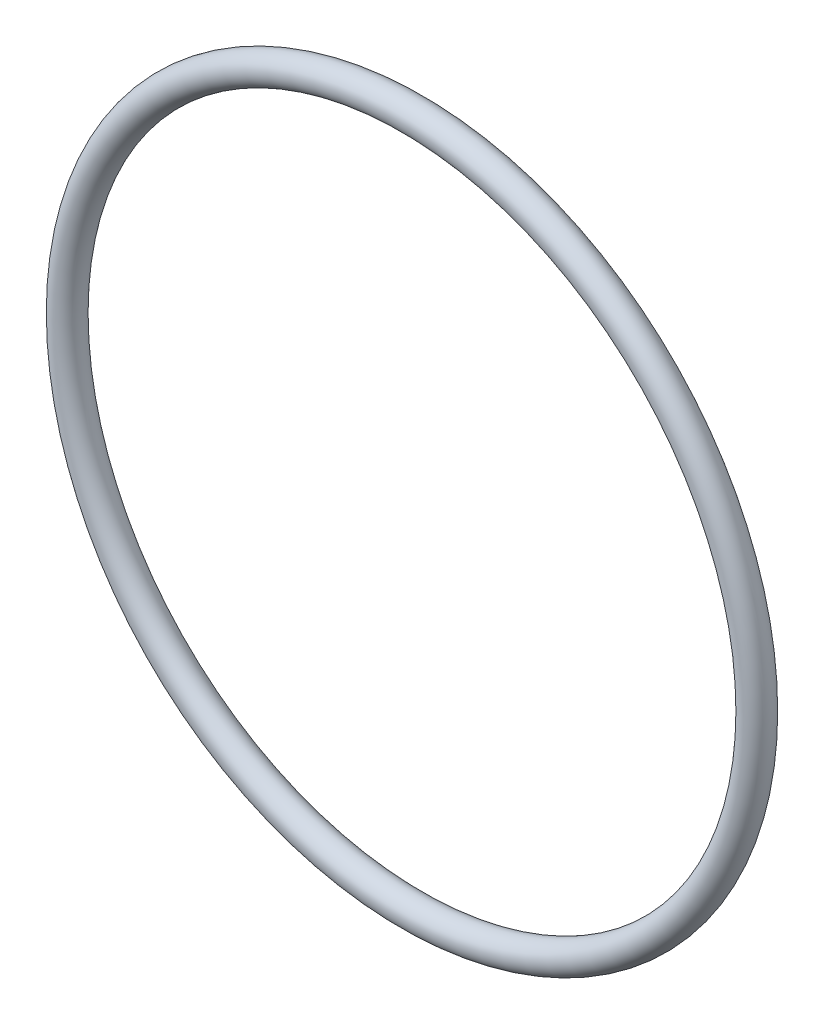
from build123d import *

# Parameters (mm, degrees)
SKETCH1_R = 1.3081


with BuildPart() as part:
    # Sketch1 → Revolve1 (revolve)
    with BuildSketch(Plane(origin=(0, 0, 0), x_dir=(0, -1, 0), z_dir=(1, 0, 0))):
        with Locations((30.5181, 0)):
            Circle(SKETCH1_R)
    revolve(axis=Axis((0, 0, 1.3081), (0, 0, -1)))


solid = part.part
